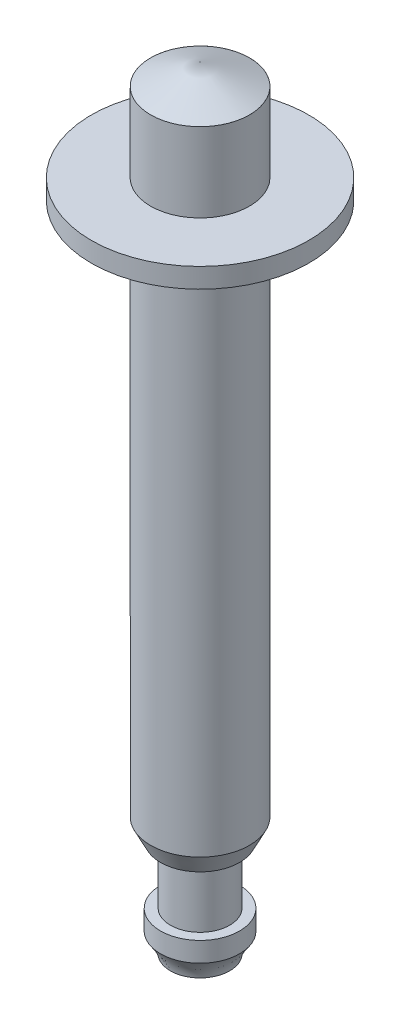
from build123d import *

# Parameters (mm, degrees)
SKETCH1_R           = 2
BOSS_EXTRUDE1_DEPTH = 1
SKETCH3_R           = 1.5
BOSS_EXTRUDE2_DEPTH = 3
SKETCH4_R           = 2
SKETCH5_R           = 2.5
SKETCH5_2_R         = 2.5
BOSS_EXTRUDE4_DEPTH = 26
SKETCH9_R           = 3
BOSS_EXTRUDE5_DEPTH = 1
SKETCH10_R          = 5.5
BOSS_EXTRUDE6_DEPTH = 1
SKETCH11_R          = 2.5
BOSS_EXTRUDE7_DEPTH = 4


with BuildPart() as part:
    # Sketch1 → Boss-Extrude1 (new body)
    with BuildSketch(Plane(origin=(0, 0, 0), x_dir=(1, 0, 0), z_dir=(0, 1, 0))):
        with Locations(Location((0, 0, 0), (0, 0, 270))):
            Circle(SKETCH1_R)
    extrude(amount=-BOSS_EXTRUDE1_DEPTH)

    # Loft1: read off the stored shape, not the designer's step
    # Loft1: loft between two sections, ruled curve by curve
    loft1_from = [
        Edge.make_bspline([(0.119567695, -2, 1.495226928), (3.110021551, -2, 1.256091538), (2.870886161, -2, -1.734362318), (-0.119567695, -2, -1.495226928), (-3.110021551, -2, -1.256091538), (-2.870886161, -2, 1.734362318), (0.119567695, -2, 1.495226928)], [0, 0, 0, 0, 0.5, 0.5, 0.5, 1, 1, 1, 1], 3, [1, 0.333333333, 0.333333333, 1, 0.333333333, 0.333333333, 1]),
    ]
    loft1_to = [
        Edge.make_bspline([(-0.945839766, -1, 1.762210866), (2.578581967, -1, 3.653890398), (4.470261498, -1, 0.129468665), (0.945839766, -1, -1.762210866), (-2.578581967, -1, -3.653890398), (-4.470261498, -1, -0.129468665), (-0.945839766, -1, 1.762210866)], [0, 0, 0, 0, 0.5, 0.5, 0.5, 1, 1, 1, 1], 3, [1, 0.333333333, 0.333333333, 1, 0.333333333, 0.333333333, 1]),
    ]
    loft1 = Solid(Shell([*[Face.make_surface_from_curves(loft1_from[k], loft1_to[k]) for k in range(1)], Face(Wire(loft1_from)), Face(Wire(loft1_to))]))
    add(loft1)

    # Sketch3 → Boss-Extrude2 (add)
    with BuildSketch(Plane(origin=(0, 0, 0), x_dir=(1, 0, 0), z_dir=(0, 1, 0))):
        with Locations(Location((0, 0, 0), (0, 0, 270))):
            Circle(SKETCH3_R)
    extrude(amount=BOSS_EXTRUDE2_DEPTH)

    # Sketch4 → Loft2 section 0
    with BuildSketch(Plane(origin=(0, 3, 0), x_dir=(1, 0, 0), z_dir=(0, 1, 0))):
        Circle(SKETCH4_R)
    # Sketch5 → Loft2 section 1
    with BuildSketch(Plane(origin=(0, 4, 0), x_dir=(1, 0, 0), z_dir=(0, 1, 0))):
        Circle(SKETCH5_R)
    loft()

    # Sketch5<2> → Boss-Extrude4 (add)
    with BuildSketch(Plane(origin=(0, 4, 0), x_dir=(1, 0, 0), z_dir=(0, 1, 0))):
        with Locations(Location((0, 0, 0), (0, 0, 90))):
            Circle(SKETCH5_2_R)
    extrude(amount=BOSS_EXTRUDE4_DEPTH)

    # Sketch9 → Boss-Extrude5 (add)
    with BuildSketch(Plane(origin=(0, 30, 0), x_dir=(1, 0, 0), z_dir=(0, 1, 0))):
        with Locations(Location((0, 0, 0), (0, 0, 270))):
            Circle(SKETCH9_R)
    extrude(amount=BOSS_EXTRUDE5_DEPTH)

    # Sketch10 → Boss-Extrude6 (add)
    with BuildSketch(Plane(origin=(0, 31, 0), x_dir=(1, 0, 0), z_dir=(0, 1, 0))):
        with Locations(Location((0, 0, 0), (0, 0, 270))):
            Circle(SKETCH10_R)
    extrude(amount=BOSS_EXTRUDE6_DEPTH)

    # Sketch11 → Boss-Extrude7 (add)
    with BuildSketch(Plane(origin=(0, 32, 0), x_dir=(1, 0, 0), z_dir=(0, 1, 0))):
        with Locations(Location((0, 0, 0), (0, 0, 90))):
            Circle(SKETCH11_R)
    extrude(amount=BOSS_EXTRUDE7_DEPTH)


with BuildPart() as body_2:
    # Sketch13 → Revolve3 (revolve)
    with BuildSketch(Plane.XY, mode=Mode.PRIVATE) as revolve3_sk:
        Polygon((0, 36.057937537), (0, 37.057937537), (2.5, 36), align=None)
    revolve(revolve3_sk.sketch.rotate(Axis((0, 43.722789751, 0), (0, -1, 0)), 270), axis=Axis((0, 43.722789751, 0), (0, -1, 0)))


solid = Compound([part.part, body_2.part])
